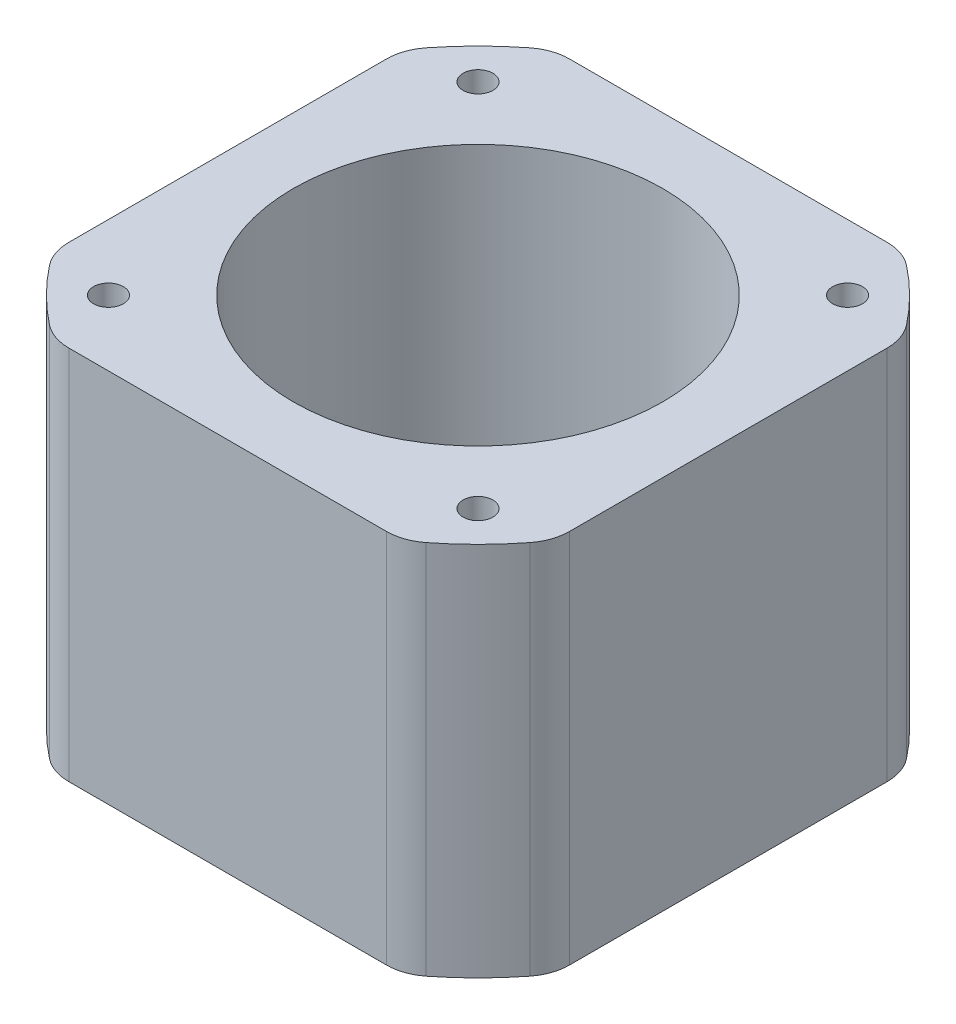
from build123d import *

# Parameters (mm, degrees)
SKETCH_1_R      = 1.25
SKETCH_1_R_2    = 15.5
EXTRUDE_1_DEPTH = 31.5
FILLET_1_R      = 4


with BuildPart() as part:
    # Эскиз1 → Бобышка-Вытянуть1 (new body)
    with BuildSketch(Plane(origin=(0, 0, 0), x_dir=(1, 0, 0), z_dir=(0, 1, 0))):
        with BuildLine():
            Line((-14.641038215, -21), (14.641038215, -21))
            ThreePointArc((14.641038215, -21), (18.101933598, -18.101933598), (21, -14.641038215))
            Line((21, -14.641038215), (21, 14.641038215))
            ThreePointArc((21, 14.641038215), (18.101933598, 18.101933598), (14.641038215, 21))
            Line((14.641038215, 21), (-14.641038215, 21))
            ThreePointArc((-14.641038215, 21), (-18.101933598, 18.101933598), (-21, 14.641038215))
            Line((-21, 14.641038215), (-21, -14.641038215))
            ThreePointArc((-21, -14.641038215), (-18.101933598, -18.101933598), (-14.641038215, -21))
        make_face()
        with Locations((-15.5, 15.5)):
            Circle(SKETCH_1_R, mode=Mode.SUBTRACT)
        with Locations((15.5, 15.5)):
            Circle(SKETCH_1_R, mode=Mode.SUBTRACT)
        with Locations((15.5, -15.5)):
            Circle(SKETCH_1_R, mode=Mode.SUBTRACT)
        with Locations((-15.5, -15.5)):
            Circle(SKETCH_1_R, mode=Mode.SUBTRACT)
        Circle(SKETCH_1_R_2, mode=Mode.SUBTRACT)
    extrude(amount=EXTRUDE_1_DEPTH)

    # Скругление1
    fillet_1_edges = [part.edges().sort_by_distance(p)[0] for p in [
        (-21, 15.75, -14.641038215),
        (-14.641038215, 15.75, -21),
        (14.641038215, 15.75, -21),
        (21, 15.75, -14.641038215),
        (21, 15.75, 14.641038215),
        (14.641038215, 15.75, 21),
        (-14.641038215, 15.75, 21),
        (-21, 15.75, 14.641038215),
    ]]
    fillet(fillet_1_edges, radius=FILLET_1_R)


solid = part.part
